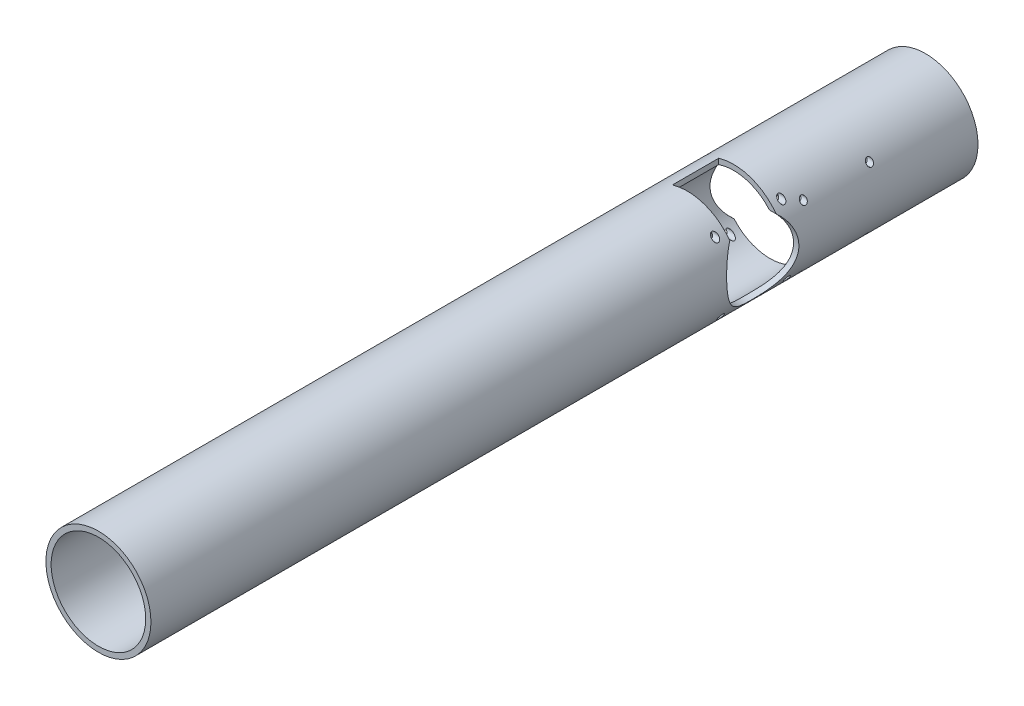
from build123d import *

# Parameters (mm, degrees)
BOSS_EXTRUDE1_DEPTH      = 250
BOSS_EXTRUDE1_DEPTH_BACK = 250
SKETCH1_R                = 31.75
SKETCH1_R_2              = 28.575
SKETCH2_R                = 21.75
CUT_EXTRUDE1_DEPTH       = 255.000246063
SKETCH3_R                = 21.75
CUT_EXTRUDE2_DEPTH       = 255.000246186
CUT_EXTRUDE4_START       = 9
SKETCH5_W                = 28
SKETCH5_H                = 22
CUT_EXTRUDE4_DEPTH       = 264.000246186
CUT_EXTRUDE5_START       = -9
SKETCH6_W                = 28
SKETCH6_H                = 22
CUT_EXTRUDE5_DEPTH       = 264.000246186
CUT_EXTRUDE7_DEPTH       = 255.000246186
CUT_EXTRUDE7_DEPTH_BACK  = 255.000246186
SKETCH9_R                = 2
CUT_EXTRUDE8_DEPTH       = 255.000246186
CUT_EXTRUDE8_DEPTH_BACK  = 255.000246186
SKETCH11_R               = 2


with BuildPart() as part:
    # Sketch1 → Boss-Extrude1 (new, two sides: drawn at the far end of the back side and taken through both)
    with BuildSketch(Plane.XY.offset(-BOSS_EXTRUDE1_DEPTH_BACK)):
        Circle(SKETCH1_R)
        Circle(SKETCH1_R_2, mode=Mode.SUBTRACT)
    extrude(amount=BOSS_EXTRUDE1_DEPTH + BOSS_EXTRUDE1_DEPTH_BACK)

    # Sketch2 → Cut-Extrude1 (cut, through all)
    with BuildSketch(Plane(origin=(0, 0, 0), x_dir=(0, 0, -1), z_dir=(1, 0, 0))):
        with Locations((170, -2)):
            Circle(SKETCH2_R)
    extrude(amount=-CUT_EXTRUDE1_DEPTH, mode=Mode.SUBTRACT)

    # Sketch3 → Cut-Extrude2 (cut, through all)
    with BuildSketch(Plane(origin=(0, 0, 0), x_dir=(0, 0, -1), z_dir=(1, 0, 0))):
        with Locations((120, 2)):
            Circle(SKETCH3_R)
    extrude(amount=CUT_EXTRUDE2_DEPTH, mode=Mode.SUBTRACT)

    # Sketch5 → Cut-Extrude4 (cut, through all)
    with BuildSketch(Plane(origin=(0, 0, 0), x_dir=(0, 0, -1), z_dir=(1, 0, 0)).offset(CUT_EXTRUDE4_START)):
        with Locations((170, -23.75)):
            Rectangle(SKETCH5_W, SKETCH5_H)
    extrude(amount=-CUT_EXTRUDE4_DEPTH, mode=Mode.SUBTRACT)

    # Sketch6 → Cut-Extrude5 (cut, through all)
    with BuildSketch(Plane(origin=(0, 0, 0), x_dir=(0, 0, -1), z_dir=(1, 0, 0)).offset(CUT_EXTRUDE5_START)):
        with Locations((120, 23.75)):
            Rectangle(SKETCH6_W, SKETCH6_H)
    extrude(amount=CUT_EXTRUDE5_DEPTH, mode=Mode.SUBTRACT)

    # Sketch9 → Cut-Extrude7 (cut, two sides: drawn at the far end of the back side and taken through both)
    with BuildSketch(Plane(origin=(0, 0, 0), x_dir=(0, 0, -1), z_dir=(1, 0, 0)).offset(-CUT_EXTRUDE7_DEPTH_BACK)):
        with Locations((100, 22)):
            Circle(SKETCH9_R)
        with Locations((140, 22)):
            Circle(SKETCH9_R)
        with Locations((140, -18)):
            Circle(SKETCH9_R)
        with Locations((100, -18)):
            Circle(SKETCH9_R)
    extrude(amount=CUT_EXTRUDE7_DEPTH + CUT_EXTRUDE7_DEPTH_BACK, mode=Mode.SUBTRACT)

    # Sketch11 → Cut-Extrude8 (cut, two sides: drawn at the far end of the back side and taken through both)
    with BuildSketch(Plane(origin=(0, 0, 0), x_dir=(0, 0, -1), z_dir=(1, 0, 0)).offset(-CUT_EXTRUDE8_DEPTH_BACK)):
        with Locations((190, 18)):
            Circle(SKETCH11_R)
        with Locations((150, 18)):
            Circle(SKETCH11_R)
        with Locations((150, -22)):
            Circle(SKETCH11_R)
        with Locations((190, -22)):
            Circle(SKETCH11_R)
    extrude(amount=CUT_EXTRUDE8_DEPTH + CUT_EXTRUDE8_DEPTH_BACK, mode=Mode.SUBTRACT)


solid = part.part
